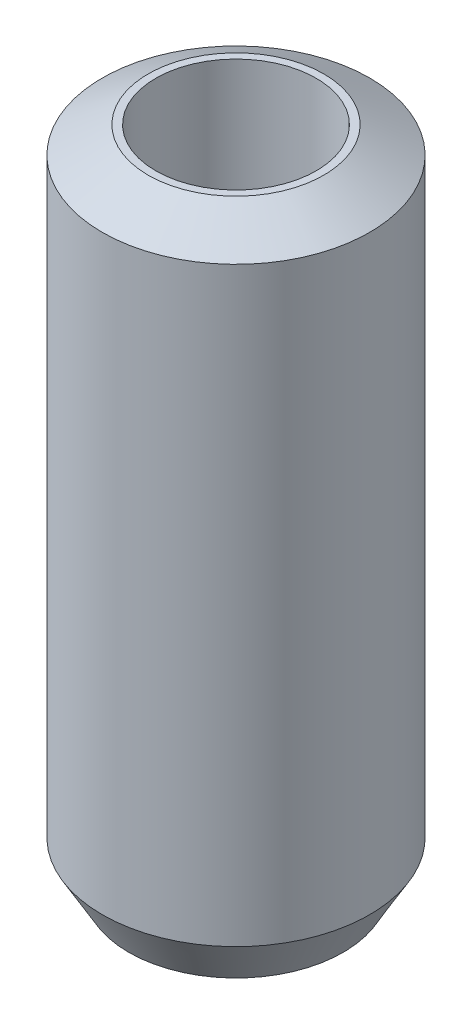
from build123d import *
from OCP.BRepFilletAPI import BRepFilletAPI_MakeChamfer

# Parameters (mm, degrees)
SKETCH1_R           = 12.5
BOSS_EXTRUDE1_DEPTH = 62.007275545
SKETCH2_R           = 7.500422009
CUT_EXTRUDE1_DEPTH  = 65.477920411
CHAMFER1_SIZE       = 2.478690594
CHAMFER1_SIZE2      = 4.293218045


with BuildPart() as part:
    # Sketch1 → Boss-Extrude1 (new body)
    with BuildSketch(Plane(origin=(0, 0, 0), x_dir=(1, 0, 0), z_dir=(0, 1, 0))):
        Circle(SKETCH1_R)
    extrude(amount=BOSS_EXTRUDE1_DEPTH)

    # Sketch2 → Cut-Extrude1 (cut, through all)
    with BuildSketch(Plane(origin=(0, 0, 0), x_dir=(1, 0, 0), z_dir=(0, 1, 0))):
        Circle(SKETCH2_R)
    extrude(amount=CUT_EXTRUDE1_DEPTH, mode=Mode.SUBTRACT)

    # Chamfer1: one chamfer whose edges measure the first distance from different faces: ONE call of the kernel's chamfer builder (chamfer() names one face for all edges)
    chamfer1_edges_1 = [part.edges().sort_by_distance(p)[0] for p in [
        (-12.5, 62.007275545, 0),
    ]]
    chamfer1_side_1 = [part.faces().sort_by_distance(p)[0] for p in [
        (-12.5, 31.003637772, 0),
    ]]
    chamfer1_edges_2 = [part.edges().sort_by_distance(p)[0] for p in [
        (-12.5, 0, 0),
    ]]
    chamfer1_side_2 = [part.faces().sort_by_distance(p)[0] for p in [
        (-12.146446609, 0, 0),
    ]]
    chamfer1 = BRepFilletAPI_MakeChamfer(part.part.solid().wrapped)
    for e in chamfer1_edges_1:
        chamfer1.Add(CHAMFER1_SIZE, CHAMFER1_SIZE2, e.wrapped, chamfer1_side_1[0].wrapped)  # the first distance lies on this face
    for e in chamfer1_edges_2:
        chamfer1.Add(CHAMFER1_SIZE, CHAMFER1_SIZE2, e.wrapped, chamfer1_side_2[0].wrapped)  # the first distance lies on this face
    add(Compound.cast(chamfer1.Shape()), mode=Mode.REPLACE)


solid = part.part
